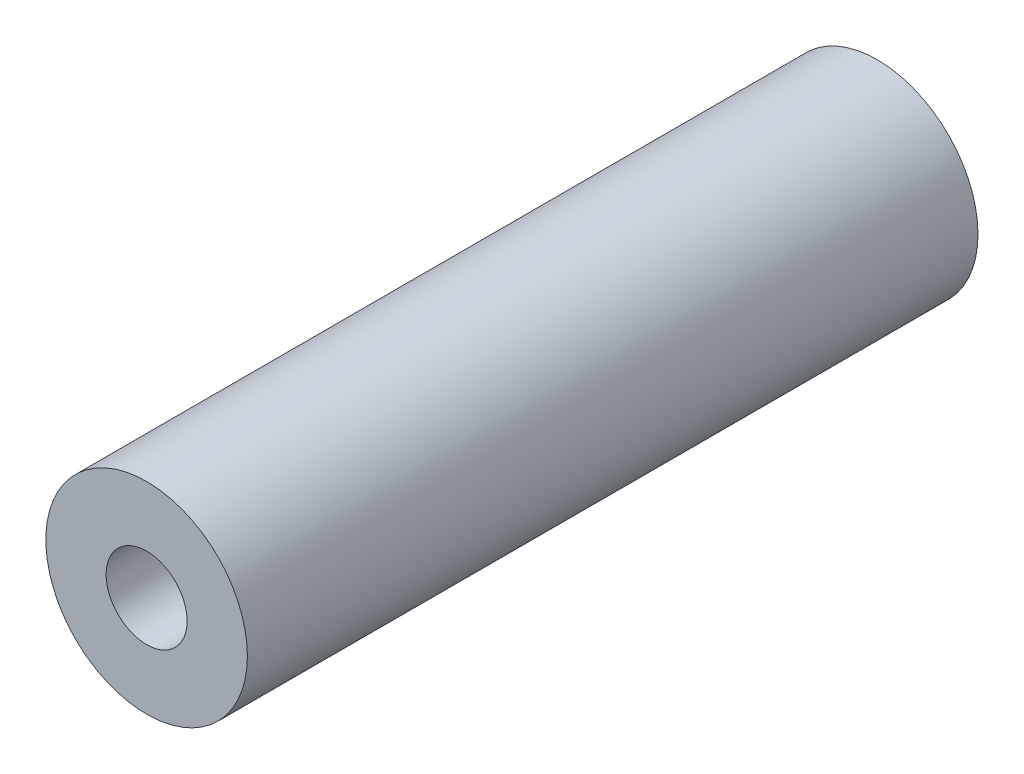
from build123d import *

# Parameters (mm, degrees)
SKETCH1_R           = 6.35
SKETCH1_R_2         = 2.5527
BOSS_EXTRUDE1_DEPTH = 23.01875


with BuildPart() as part:
    # Sketch1 → Boss-Extrude1 (new, symmetric)
    with BuildSketch(Plane.XY):
        Circle(SKETCH1_R)
        Circle(SKETCH1_R_2, mode=Mode.SUBTRACT)
    extrude(amount=BOSS_EXTRUDE1_DEPTH, both=True)


solid = part.part
